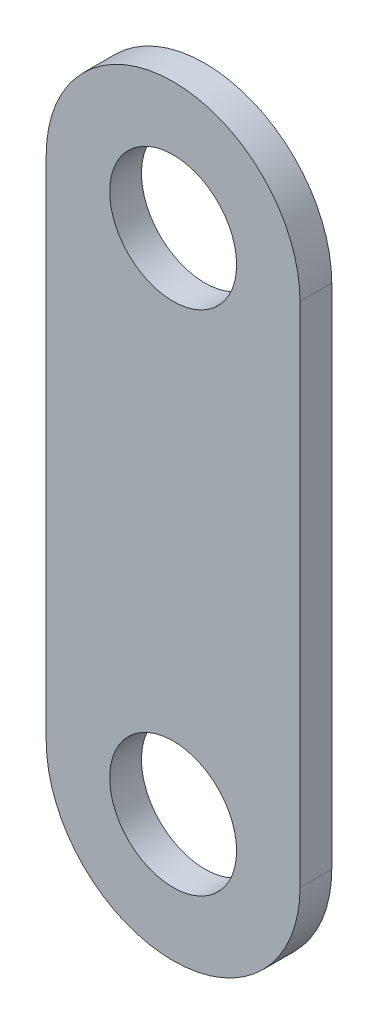
from build123d import *

# Parameters (mm, degrees)
SKETCH1_R           = 6.35
BOSS_EXTRUDE1_DEPTH = 3.175


with BuildPart() as part:
    # Sketch1 → Boss-Extrude1 (new body)
    with BuildSketch(Plane.XY):
        with BuildLine():
            Line((-29.913222871, 25.742348898), (-29.913222871, -25.057651102))
            ThreePointArc((-29.913222871, -25.057651102), (-17.213222871, -37.757651102), (-4.513222871, -25.057651102))
            Line((-4.513222871, -25.057651102), (-4.513222871, 25.742348898))
            ThreePointArc((-4.513222871, 25.742348898), (-17.213222871, 38.442348898), (-29.913222871, 25.742348898))
        make_face()
        with Locations((-17.213222871, 25.742348898)):
            Circle(SKETCH1_R, mode=Mode.SUBTRACT)
        with Locations((-17.213222871, -25.057651102)):
            Circle(SKETCH1_R, mode=Mode.SUBTRACT)
    extrude(amount=BOSS_EXTRUDE1_DEPTH)


solid = part.part
